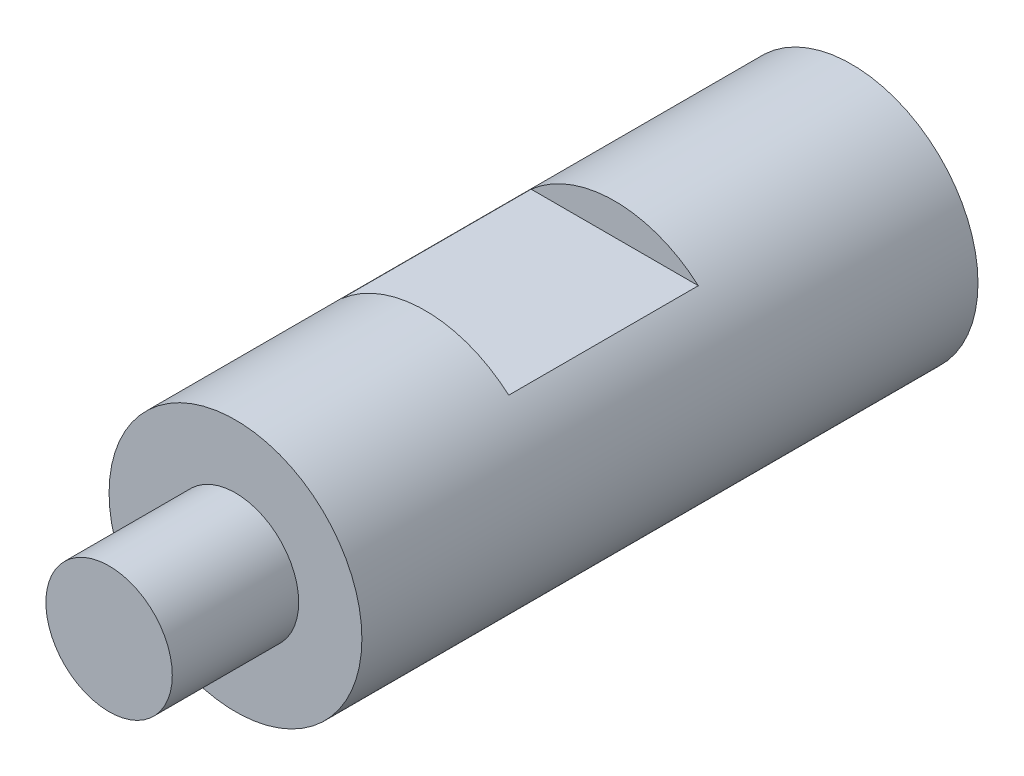
from build123d import *

# Parameters (mm, degrees)
SKETCH2_R                       = 6.35
BOSS_EXTRUDE1_DEPTH             = 30.9499
TAP_DRILL_FOR_1_4_20_TAP1_D     = 5.1054
TAP_DRILL_FOR_1_4_20_TAP1_DEPTH = 12.7
TAP_DRILL_FOR_1_4_20_TAP1_TIP   = 1.533816902
SKETCH6_R                       = 3.175
BOSS_EXTRUDE2_DEPTH             = 6.35
CUT_EXTRUDE1_DEPTH              = 39.365707865
CUT_EXTRUDE1_DEPTH_BACK         = 39.365707865
SKETCH7_W                       = 1.5875
SKETCH7_H                       = 9.525


with BuildPart() as part:
    # Sketch2 → Boss-Extrude1 (new body)
    with BuildSketch(Plane(origin=(0, 0, 0), x_dir=(0, 1, 0), z_dir=(0, 0, 1))):
        Circle(SKETCH2_R)
    extrude(amount=BOSS_EXTRUDE1_DEPTH)

    # Tap Drill for 1/4-20 Tap1
    with Locations(Plane(origin=(0, 0, 0), x_dir=(-1, 0, 0), z_dir=(0, 0, -1))):
        with Locations((0, 0)):
            Hole(TAP_DRILL_FOR_1_4_20_TAP1_D / 2, depth=TAP_DRILL_FOR_1_4_20_TAP1_DEPTH)
            with Locations((0, 0, -(TAP_DRILL_FOR_1_4_20_TAP1_DEPTH + TAP_DRILL_FOR_1_4_20_TAP1_TIP / 2))):  # 118° drill point
                Cone(0, TAP_DRILL_FOR_1_4_20_TAP1_D / 2, TAP_DRILL_FOR_1_4_20_TAP1_TIP, mode=Mode.SUBTRACT)

    # Sketch6 → Boss-Extrude2 (add)
    with BuildSketch(Plane.XY.offset(30.9499)):
        Circle(SKETCH6_R)
    extrude(amount=BOSS_EXTRUDE2_DEPTH)

    # Sketch7 → Cut-Extrude1 (cut, two sides: drawn at the far end of the back side and taken through both)
    with BuildSketch(Plane.YZ.offset(-CUT_EXTRUDE1_DEPTH_BACK)):
        with Locations((-5.55625, 16.6624)):
            Rectangle(SKETCH7_W, SKETCH7_H)
        with Locations((5.55625, 16.6624)):
            Rectangle(SKETCH7_W, SKETCH7_H)
    extrude(amount=CUT_EXTRUDE1_DEPTH + CUT_EXTRUDE1_DEPTH_BACK, mode=Mode.SUBTRACT)


solid = part.part
